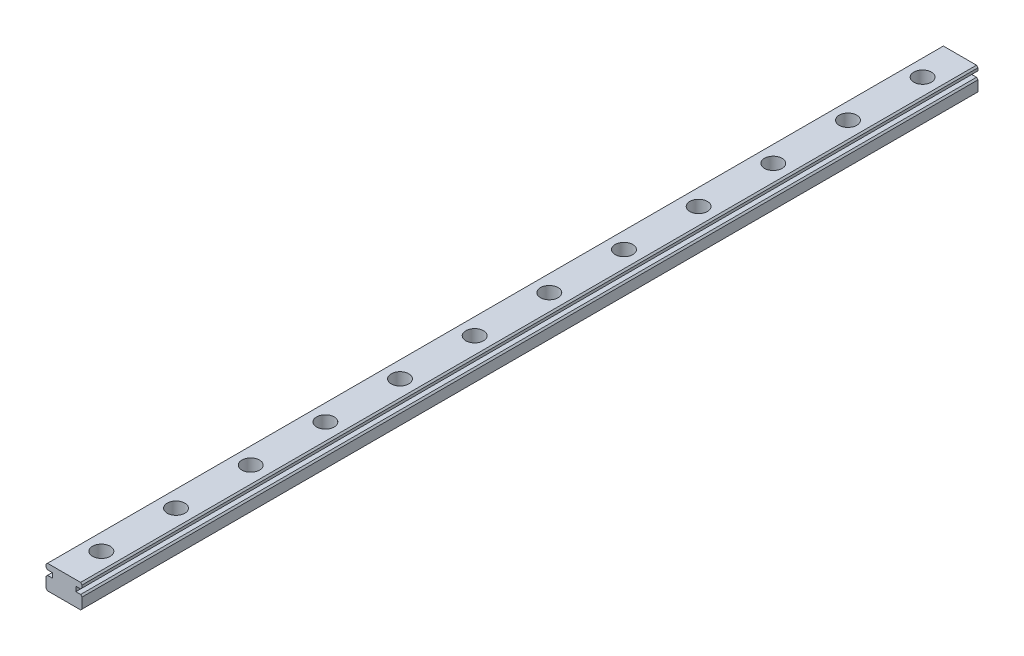
from build123d import *

# Parameters (mm, degrees)
BOSS_EXTRUDE1_DEPTH = 300
CHAMFER1_SIZE       = 0.5
SKETCH2_R           = 1.6
CUT_EXTRUDE1_DEPTH  = 200
CUT_EXTRUDE2_START  = -5.6
SKETCH3_R           = 2.95
SKETCH3_R_2         = 1.6
CUT_EXTRUDE2_DEPTH  = 5.6


with BuildPart() as part:
    # Sketch1 → Boss-Extrude1 (new body)
    with BuildSketch(Plane.XY):
        Polygon((3.95, 2.1), (6.05, 2.1), (6.05, 4), (-6.05, 4), (-6.05, 2.1), (-3.95, 2.1), (-3.95, 0.5), (-6.05, 0.5), (-6.05, -4), (6.05, -4), (6.05, 0.5), (3.95, 0.5), align=None)
    extrude(amount=BOSS_EXTRUDE1_DEPTH)

    # Chamfer1
    chamfer1_edges = [part.edges().sort_by_distance(p)[0] for p in [
        (6.05, -4, 150),
        (-6.05, -4, 150),
        (-6.05, 0.5, 150),
        (-6.05, 2.1, 150),
        (-6.05, 4, 150),
        (6.05, 4, 150),
        (6.05, 2.1, 150),
        (6.05, 0.5, 150),
    ]]
    chamfer(chamfer1_edges, length=CHAMFER1_SIZE)

    # Sketch2 → Cut-Extrude1 (cut)
    with BuildSketch(Plane.XZ.offset(4)):
        with Locations((0, 137.5)):
            Circle(SKETCH2_R)
        with Locations((0, 162.5)):
            Circle(SKETCH2_R)
        with Locations((0, 112.5)):
            Circle(SKETCH2_R)
        with Locations((0, 187.5)):
            Circle(SKETCH2_R)
        with Locations((0, 87.5)):
            Circle(SKETCH2_R)
        with Locations((0, 212.5)):
            Circle(SKETCH2_R)
        with Locations((0, 62.5)):
            Circle(SKETCH2_R)
        with Locations((0, 237.5)):
            Circle(SKETCH2_R)
        with Locations((0, 262.5)):
            Circle(SKETCH2_R)
        with Locations((0, 287.5)):
            Circle(SKETCH2_R)
        with Locations((0, 37.5)):
            Circle(SKETCH2_R)
        with Locations((0, 12.5)):
            Circle(SKETCH2_R)
    extrude(amount=-CUT_EXTRUDE1_DEPTH, mode=Mode.SUBTRACT)

    # Sketch3 → Cut-Extrude2 (cut)
    # profile 1 of 12: a face of its own
    with BuildSketch(Plane(origin=(0, 4, 0), x_dir=(1, 0, 0), z_dir=(0, 1, 0)).offset(CUT_EXTRUDE2_START)):
        with Locations((0, -237.5)):
            Circle(SKETCH3_R)
        with Locations((0, -237.5)):
            Circle(SKETCH3_R_2, mode=Mode.SUBTRACT)
    # profile 2 of 12: a face of its own
    with BuildSketch(Plane(origin=(0, 4, 0), x_dir=(1, 0, 0), z_dir=(0, 1, 0)).offset(CUT_EXTRUDE2_START)):
        with Locations((0, -187.5)):
            Circle(SKETCH3_R)
        with Locations((0, -187.5)):
            Circle(SKETCH3_R_2, mode=Mode.SUBTRACT)
    # profile 3 of 12: a face of its own
    with BuildSketch(Plane(origin=(0, 4, 0), x_dir=(1, 0, 0), z_dir=(0, 1, 0)).offset(CUT_EXTRUDE2_START)):
        with Locations((0, -112.5)):
            Circle(SKETCH3_R)
        with Locations((0, -112.5)):
            Circle(SKETCH3_R_2, mode=Mode.SUBTRACT)
    # profile 4 of 12: a face of its own
    with BuildSketch(Plane(origin=(0, 4, 0), x_dir=(1, 0, 0), z_dir=(0, 1, 0)).offset(CUT_EXTRUDE2_START)):
        with Locations((0, -212.5)):
            Circle(SKETCH3_R)
        with Locations((0, -212.5)):
            Circle(SKETCH3_R_2, mode=Mode.SUBTRACT)
    # profile 5 of 12: a face of its own
    with BuildSketch(Plane(origin=(0, 4, 0), x_dir=(1, 0, 0), z_dir=(0, 1, 0)).offset(CUT_EXTRUDE2_START)):
        with Locations((0, -162.5)):
            Circle(SKETCH3_R)
        with Locations((0, -162.5)):
            Circle(SKETCH3_R_2, mode=Mode.SUBTRACT)
    # profile 6 of 12: a face of its own
    with BuildSketch(Plane(origin=(0, 4, 0), x_dir=(1, 0, 0), z_dir=(0, 1, 0)).offset(CUT_EXTRUDE2_START)):
        with Locations((0, -137.5)):
            Circle(SKETCH3_R)
        with Locations((0, -137.5)):
            Circle(SKETCH3_R_2, mode=Mode.SUBTRACT)
    # profile 7 of 12: a face of its own
    with BuildSketch(Plane(origin=(0, 4, 0), x_dir=(1, 0, 0), z_dir=(0, 1, 0)).offset(CUT_EXTRUDE2_START)):
        with Locations((0, -62.5)):
            Circle(SKETCH3_R)
    # profile 8 of 12: a face of its own
    with BuildSketch(Plane(origin=(0, 4, 0), x_dir=(1, 0, 0), z_dir=(0, 1, 0)).offset(CUT_EXTRUDE2_START)):
        with Locations((0, -87.5)):
            Circle(SKETCH3_R)
    # profile 9 of 12: a face of its own
    with BuildSketch(Plane(origin=(0, 4, 0), x_dir=(1, 0, 0), z_dir=(0, 1, 0)).offset(CUT_EXTRUDE2_START)):
        with Locations((0, -262.5)):
            Circle(SKETCH3_R)
    # profile 10 of 12: a face of its own
    with BuildSketch(Plane(origin=(0, 4, 0), x_dir=(1, 0, 0), z_dir=(0, 1, 0)).offset(CUT_EXTRUDE2_START)):
        with Locations((0, -287.5)):
            Circle(SKETCH3_R)
    # profile 11 of 12: a face of its own
    with BuildSketch(Plane(origin=(0, 4, 0), x_dir=(1, 0, 0), z_dir=(0, 1, 0)).offset(CUT_EXTRUDE2_START)):
        with Locations((0, -12.5)):
            Circle(SKETCH3_R)
        with Locations((0, -12.5)):
            Circle(SKETCH3_R_2, mode=Mode.SUBTRACT)
    # profile 12 of 12: a face of its own
    with BuildSketch(Plane(origin=(0, 4, 0), x_dir=(1, 0, 0), z_dir=(0, 1, 0)).offset(CUT_EXTRUDE2_START)):
        with Locations((0, -37.5)):
            Circle(SKETCH3_R)
    extrude(amount=CUT_EXTRUDE2_DEPTH, mode=Mode.SUBTRACT)


solid = part.part
